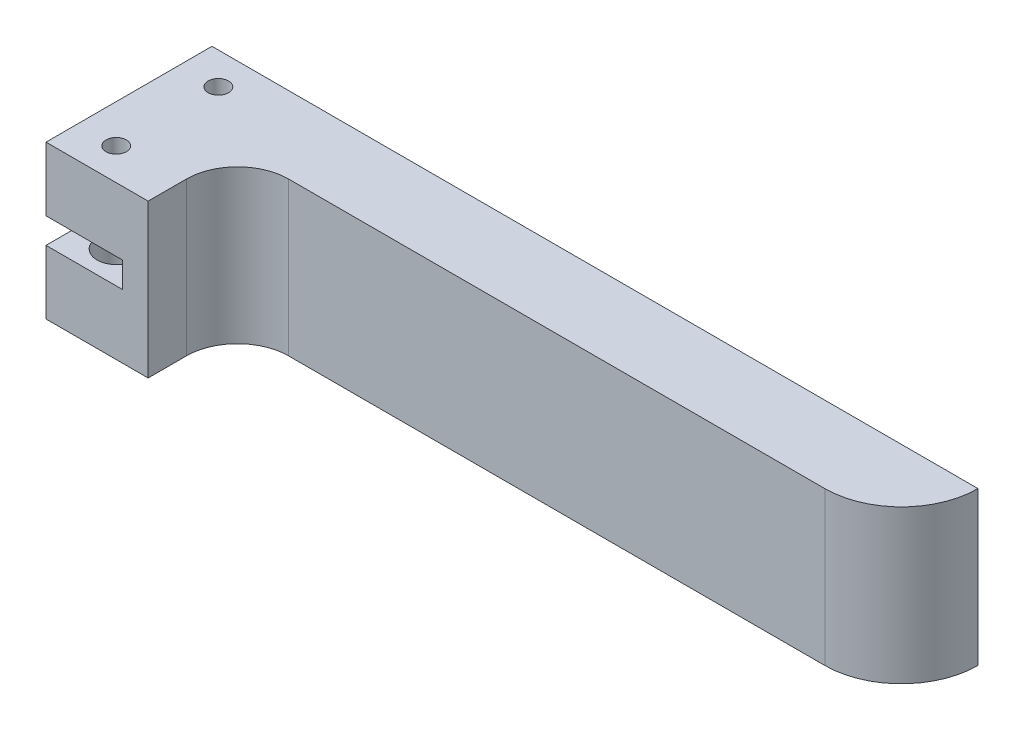
from build123d import *

# Parameters (mm, degrees)
SKETCH1_W           = 40
SKETCH1_H           = 13
BOSS_EXTRUDE1_DEPTH = 6
SKETCH2_W           = 6
SKETCH2_H           = 2
CUT_EXTRUDE1_DEPTH  = 25.596747752
SKETCH3_R           = 0.8
CUT_EXTRUDE2_DEPTH  = 2
SKETCH4_W           = 32
SKETCH4_H           = 7
CUT_EXTRUDE3_DEPTH  = 22.868927729
FILLET1_R           = 4
SKETCH5_R           = 1.5
CUT_EXTRUDE4_DEPTH  = 2
SKETCH6_W           = 6
SKETCH6_H           = 6
BOSS_EXTRUDE2_DEPTH = 20
FILLET3_R           = 6
SKETCH7_R           = 1.5
BOSS_EXTRUDE3_DEPTH = 3
BOSS_EXTRUDE4_START = 3
SKETCH8_R           = 0.8
BOSS_EXTRUDE4_DEPTH = 3


with BuildPart() as part:
    # Sketch1 → Boss-Extrude1 (new body)
    with BuildSketch(Plane(origin=(0, 0, 0), x_dir=(1, 0, 0), z_dir=(0, 1, 0))):
        Rectangle(SKETCH1_W, SKETCH1_H)
    extrude(amount=BOSS_EXTRUDE1_DEPTH)

    # Sketch2 → Cut-Extrude1 (cut, through all)
    with BuildSketch(Plane.XY.offset(6.5)):
        with Locations((-17, 3)):
            Rectangle(SKETCH2_W, SKETCH2_H)
    extrude(amount=-CUT_EXTRUDE1_DEPTH, mode=Mode.SUBTRACT)

    # Sketch3 → Cut-Extrude2 (cut)
    with BuildSketch(Plane(origin=(0, 6, 0), x_dir=(1, 0, 0), z_dir=(0, 1, 0))):
        with Locations(Location((-17, 4, 0), (0, 0, 270))):
            Circle(SKETCH3_R)
        with Locations(Location((-17, -4, 0), (0, 0, 270))):
            Circle(SKETCH3_R)
    extrude(amount=-CUT_EXTRUDE2_DEPTH, mode=Mode.SUBTRACT)

    # Sketch4 → Cut-Extrude3 (cut, through all)
    with BuildSketch(Plane(origin=(0, 6, 0), x_dir=(1, 0, 0), z_dir=(0, 1, 0))):
        with Locations((4, -3)):
            Rectangle(SKETCH4_W, SKETCH4_H)
    extrude(amount=-CUT_EXTRUDE3_DEPTH, mode=Mode.SUBTRACT)

    # Fillet1
    fillet1_edges = [part.edges().sort_by_distance(p)[0] for p in [
        (-12, 3, -0.5),
    ]]
    fillet(fillet1_edges, radius=FILLET1_R)

    # Sketch5 → Cut-Extrude4 (cut)
    with BuildSketch(Plane(origin=(0, 2, 0), x_dir=(1, 0, 0), z_dir=(0, 1, 0))):
        with Locations(Location((-17, 4, 0), (0, 0, 270))):
            Circle(SKETCH5_R)
        with Locations(Location((-17, -4, 0), (0, 0, 270))):
            Circle(SKETCH5_R)
    extrude(amount=-CUT_EXTRUDE4_DEPTH, mode=Mode.SUBTRACT)

    # Sketch6 → Boss-Extrude2 (add)
    with BuildSketch(Plane(origin=(20, 0, 0), x_dir=(0, 0, -1), z_dir=(1, 0, 0))):
        with Locations((3.5, 3)):
            Rectangle(SKETCH6_W, SKETCH6_H)
    extrude(amount=BOSS_EXTRUDE2_DEPTH)

    # Fillet3
    fillet3_edges = [part.edges().sort_by_distance(p)[0] for p in [
        (40, 3, -0.5),
    ]]
    fillet(fillet3_edges, radius=FILLET3_R - 0.0001)  # a hair under: the kernel refuses the full size

    # Sketch7 → Boss-Extrude3 (add)
    with BuildSketch(Plane.XZ):
        with BuildLine():
            Line((-20, -6.5), (40, -6.5))
            ThreePointArc((40, -6.5), (38.242640687, -2.257359313), (34, -0.5))
            Line((34, -0.5), (-8, -0.5))
            ThreePointArc((-8, -0.5), (-10.828427125, 0.671572875), (-12, 3.5))
            Line((-12, 3.5), (-12, 6.5))
            Line((-12, 6.5), (-20, 6.5))
            Line((-20, 6.5), (-20, -6.5))
        make_face()
        with Locations(Location((-17, 4, 0), (0, 0, 90))):
            Circle(SKETCH7_R, mode=Mode.SUBTRACT)
        with Locations(Location((-17, -4, 0), (0, 0, 90))):
            Circle(SKETCH7_R, mode=Mode.SUBTRACT)
    extrude(amount=BOSS_EXTRUDE3_DEPTH)

    # Sketch8 → Boss-Extrude4 (add)
    with BuildSketch(Plane(origin=(0, 6, 0), x_dir=(1, 0, 0), z_dir=(0, 1, 0)).offset(BOSS_EXTRUDE4_START)):
        with BuildLine():
            Line((-8, 0.5), (34, 0.5))
            ThreePointArc((34, 0.5), (38.242640687, 2.257359313), (40, 6.5))
            Line((40, 6.5), (-20, 6.5))
            Line((-20, 6.5), (-20, -6.5))
            Line((-20, -6.5), (-12, -6.5))
            Line((-12, -6.5), (-12, -3.5))
            ThreePointArc((-12, -3.5), (-10.828427125, -0.671572875), (-8, 0.5))
        make_face()
        with Locations(Location((-17, -4, 0), (0, 0, 270))):
            Circle(SKETCH8_R, mode=Mode.SUBTRACT)
        with Locations(Location((-17, 4, 0), (0, 0, 270))):
            Circle(SKETCH8_R, mode=Mode.SUBTRACT)
    extrude(amount=-BOSS_EXTRUDE4_DEPTH)


solid = part.part
